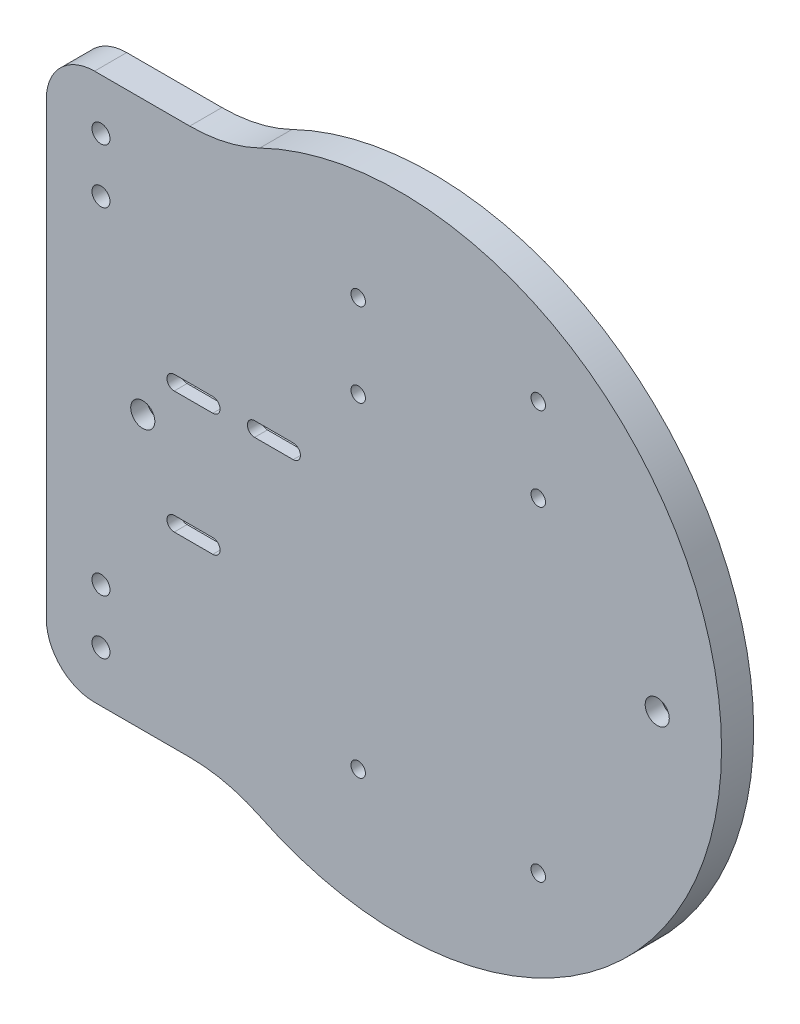
from build123d import *

# Parameters (mm, degrees)
SALIENTE_EXTRUIR2_DEPTH                              = 10
REDONDEO3_R                                          = 15
REDONDEO5_R                                          = 50
CROQUIS4_R                                           = 2.800000001
CROQUIS4_R_2                                         = 2.25
CORTAR_EXTRUIR1_DEPTH                                = 149.996644258
REFRENTADO_PARA_TORNILLO_CON_CABEZA_TRON_D           = 4.5
REFRENTADO_PARA_TORNILLO_CON_CABEZA_TRON_CBORE_D     = 7.5
REFRENTADO_PARA_TORNILLO_CON_CABEZA_TRON_CBORE_DEPTH = 5
CORTAR_EXTRUIR2_DEPTH                                = 6


with BuildPart() as part:
    # Croquis2 → Saliente-Extruir2 (new body)
    with BuildSketch(Plane(origin=(0, 0, 0), x_dir=(0, 1, 0), z_dir=(0, 0, 1))):
        with BuildLine():
            Line((-85, 52.678268764), (-85, 110))
            Line((-85, 110), (85, 110))
            Line((85, 110), (85, 52.678268764))
            ThreePointArc((85, 52.678268764), (0, -100), (-85, 52.678268764))
        make_face()
    extrude(amount=SALIENTE_EXTRUIR2_DEPTH)

    # Redondeo3
    redondeo3_edges = [part.edges().sort_by_distance(p)[0] for p in [
        (-110, 85, 5),
        (-110, -85, 5),
    ]]
    fillet(redondeo3_edges, radius=REDONDEO3_R)

    # Redondeo5
    redondeo5_edges = [part.edges().sort_by_distance(p)[0] for p in [
        (-52.678268764, 85, 5),
        (-52.678268764, -85, 5),
    ]]
    fillet(redondeo5_edges, radius=REDONDEO5_R)

    # Croquis4 → Cortar-Extruir1 (cut, through all)
    with BuildSketch(Plane.XY.offset(10)):
        with Locations((-93, 69.199999997)):
            Circle(CROQUIS4_R)
        with Locations((-93, 52.279001064)):
            Circle(CROQUIS4_R)
        with Locations((-93, -52.279001071)):
            Circle(CROQUIS4_R)
        with Locations((-93, -69.200000003)):
            Circle(CROQUIS4_R)
        with Locations((-13, 39)):
            Circle(CROQUIS4_R_2)
        with Locations((43, 39)):
            Circle(CROQUIS4_R_2)
        with Locations((-13, 65)):
            Circle(CROQUIS4_R_2)
        with Locations((43, 65)):
            Circle(CROQUIS4_R_2)
        with Locations((-13, -62)):
            Circle(CROQUIS4_R_2)
        with Locations((43, -62)):
            Circle(CROQUIS4_R_2)
        with BuildLine():
            Line((-58.219532094, 11.25), (-70.219532094, 11.25))
            ThreePointArc((-70.219532094, 11.25), (-72.469532094, 13.5), (-70.219532094, 15.75))
            Line((-70.219532094, 15.75), (-58.219532094, 15.75))
            ThreePointArc((-58.219532094, 15.75), (-55.969532094, 13.5), (-58.219532094, 11.25))
        make_face()
        with BuildLine():
            Line((-33.219532094, 11.25), (-45.219532094, 11.25))
            ThreePointArc((-45.219532094, 11.25), (-47.469532094, 13.5), (-45.219532094, 15.75))
            Line((-45.219532094, 15.75), (-33.219532094, 15.75))
            ThreePointArc((-33.219532094, 15.75), (-30.969532094, 13.5), (-33.219532094, 11.25))
        make_face()
        with BuildLine():
            Line((-58.219532094, -26.75), (-70.219532094, -26.75))
            ThreePointArc((-70.219532094, -26.75), (-72.469532094, -24.5), (-70.219532094, -22.25))
            Line((-70.219532094, -22.25), (-58.219532094, -22.25))
            ThreePointArc((-58.219532094, -22.25), (-55.969532094, -24.5), (-58.219532094, -26.75))
        make_face()
    extrude(amount=-CORTAR_EXTRUIR1_DEPTH, mode=Mode.SUBTRACT)

    # Refrentado para tornillo con cabeza troncocónica de M41 (through all)
    with Locations(Plane.XY.offset(10)):
        with Locations((-80, 0), (80, 0)):
            CounterBoreHole(REFRENTADO_PARA_TORNILLO_CON_CABEZA_TRON_D / 2, REFRENTADO_PARA_TORNILLO_CON_CABEZA_TRON_CBORE_D / 2, REFRENTADO_PARA_TORNILLO_CON_CABEZA_TRON_CBORE_DEPTH)

    # Croquis7 → Cortar-Extruir2 (cut)
    with BuildSketch(Plane(origin=(0, 0, 0), x_dir=(1, 0, 0), z_dir=(0, 0, -1))):
        with BuildLine():
            Line((-70.219532094, 29), (-58.219532094, 29))
            ThreePointArc((-58.219532094, 29), (-53.719532094, 24.5), (-58.219532094, 20))
            Line((-58.219532094, 20), (-70.219532094, 20))
            ThreePointArc((-70.219532094, 20), (-74.719532094, 24.5), (-70.219532094, 29))
        make_face()
        with BuildLine():
            Line((-70.219532094, -9), (-58.219532094, -9))
            ThreePointArc((-58.219532094, -9), (-53.719532094, -13.5), (-58.219532094, -18))
            Line((-58.219532094, -18), (-70.219532094, -18))
            ThreePointArc((-70.219532094, -18), (-74.719532094, -13.5), (-70.219532094, -9))
        make_face()
        with BuildLine():
            Line((-45.219532094, -9), (-33.219532094, -9))
            ThreePointArc((-33.219532094, -9), (-28.719532094, -13.5), (-33.219532094, -18))
            Line((-33.219532094, -18), (-45.219532094, -18))
            ThreePointArc((-45.219532094, -18), (-49.719532094, -13.5), (-45.219532094, -9))
        make_face()
    extrude(amount=-CORTAR_EXTRUIR2_DEPTH, mode=Mode.SUBTRACT)


solid = part.part
